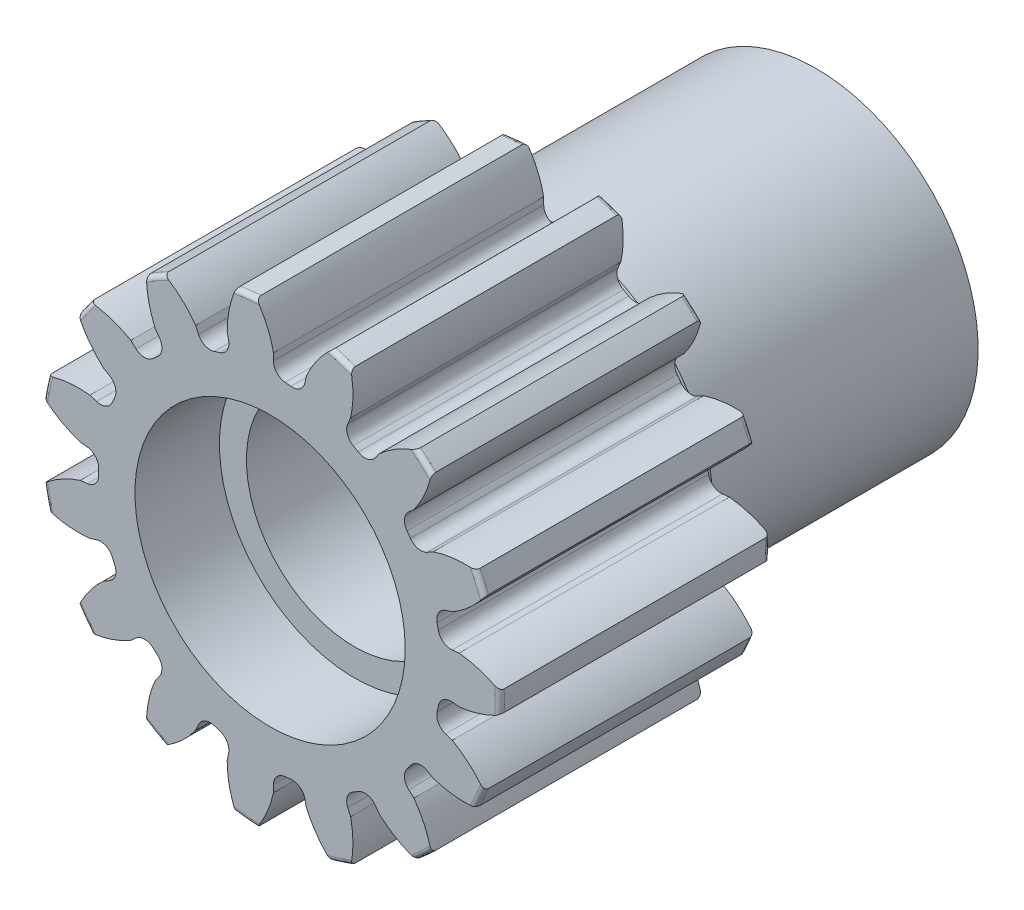
from build123d import *
from build123d.topology import SkipClean

# Parameters (mm, degrees)
SKETCH1_R                = 10.795
BOSS_EXTRUDE1_DEPTH      = 12.7
SKETCH2_W                = 11.176
SKETCH2_H                = 7.62
FILLET2_R                = 0.2159
CUT_EXTRUDE1_DEPTH       = 29.339503001
FILLET1_R                = 0.5984748
CIRPATTERN1_COUNT        = 15
FILLET1_OF_CIRPATTERN1_R = 0.5984748
SKETCH5_R                = 5.08
CUT_EXTRUDE2_DEPTH       = 29.332093844
SKETCH6_R                = 7.62
SKETCH6_R_2              = 5.08
BOSS_EXTRUDE2_DEPTH      = 1.778
SKETCH7_R                = 7.874
SKETCH7_R_2              = 7.62
BOSS_EXTRUDE3_DEPTH      = 0.254
SKETCH8_R                = 6.35
CUT_EXTRUDE3_DEPTH       = 3.96875
CUT_EXTRUDE4_START       = -3.96875
SKETCH9_R                = 6.35
CUT_EXTRUDE4_DEPTH       = 3.96875


with BuildPart() as part:
    # Sketch1 → Boss-Extrude1 (new body)
    with BuildSketch(Plane.XY):
        Circle(SKETCH1_R)
    extrude(amount=-BOSS_EXTRUDE1_DEPTH)

    # Sketch2 → Revolve1 (revolve)
    with BuildSketch(Plane(origin=(0, 0, 0), x_dir=(0, 0, -1), z_dir=(1, 0, 0))):
        with Locations((18.288, 3.81)):
            Rectangle(SKETCH2_W, SKETCH2_H)
    revolve(axis=Axis((0, 0, -12.7), (0, 0, -1)))

    # Fillet2
    fillet2_edges = [part.edges().sort_by_distance(p)[0] for p in [
        (-10.795, 0, -12.7),
        (-10.795, 0, 0),
    ]]
    fillet(fillet2_edges, radius=FILLET2_R)

    # Sketch4 → Cut-Extrude1 (cut, through all)
    with BuildSketch(Plane.XY):
        with BuildLine():
            Line((0.158117624, 8.949175479), (0.158117624, 8.054058063))
            ThreePointArc((0.158117624, 8.054058063), (0.842042496, 8.011480319), (1.51987433, 7.910931329))
            Line((1.51987433, 7.910931329), (1.705980134, 8.786488191))
            add(Edge.make_bspline(
                [(5.043237888, 11.616299545), (2.6061384, 10.812637333), (1.705980134, 8.786488191)],
                knots=[0, 0, 0, 1, 1, 1], degree=2))
            ThreePointArc((5.043237888, 11.616299545), (1.323734075, 12.594458766), (-2.517860482, 12.411004879))
            add(Edge.make_bspline(
                [(-2.517860482, 12.411004879), (-0.301108868, 11.118202053), (0.158117624, 8.949175479)],
                knots=[0, 0, 0, 1, 1, 1], degree=2))
        make_face()
    cut_extrude1 = extrude(amount=-CUT_EXTRUDE1_DEPTH, mode=Mode.SUBTRACT)

    # Fillet1
    fillet1_edges = [part.edges().sort_by_distance(p)[0] for p in [
        (1.51987433, 7.910931329, -6.35),
        (0.158117624, 8.054058063, -6.35),
    ]]
    fillet(fillet1_edges, radius=FILLET1_R)

    # CirPattern1: Cut-Extrude1 ×15 about axis
    cirpattern1_axis = Axis((0, 0, -12.7), (0, 0, 1))
    for i in range(1, CIRPATTERN1_COUNT):
        add(cut_extrude1.rotate(cirpattern1_axis, i * 360 / CIRPATTERN1_COUNT), mode=Mode.SUBTRACT)

    # Fillet1 of CirPattern1
    fillet1_of_cirpattern1_edges = [part.edges().sort_by_distance(p)[0] for p in [
        (-1.829191362, 7.845183964, -6.35),
        (-3.131432903, 7.422060391, -6.35),
        (-4.86197325, 6.422933021, -6.35),
        (-5.879530232, 5.50672105, -6.35),
        (-7.054075793, 3.890098607, -6.35),
        (-7.611003371, 2.639219612, -6.35),
        (-8.026464548, 0.684630804, -6.35),
        (-8.026464883, -0.684626873, -6.35),
        (-7.611004663, -2.639215884, -6.35),
        (-7.054077699, -3.890095152, -6.35),
        (-5.879532929, -5.50671817, -6.35),
        (-4.861976396, -6.422930639, -6.35),
        (-3.131436538, -7.422058857, -6.35),
        (-1.829195205, -7.845183068, -6.35),
        (0.15811368, -8.054058141, -6.35),
        (1.519870455, -7.910932073, -6.35),
        (3.420324605, -7.293437603, -6.35),
        (4.606136706, -6.608809055, -6.35),
        (6.091130334, -5.271715445, -6.35),
        (6.895960074, -4.163962911, -6.35),
        (7.708724292, -2.338465794, -6.35),
        (7.993409298, -0.999129752, -6.35),
        (7.993409788, 0.999125837, -6.35),
        (7.708725437, 2.338462019, -6.35),
        (6.895962114, 4.163959534, -6.35),
        (6.091132916, 5.271712461, -6.35),
        (4.606139942, 6.608806799, -6.35),
        (3.420328177, 7.293435928, -6.35),
    ]]
    fillet(fillet1_of_cirpattern1_edges, radius=FILLET1_OF_CIRPATTERN1_R)

    # Sketch5 → Cut-Extrude2 (cut, through all)
    with BuildSketch(Plane.XY):
        Circle(SKETCH5_R)
    extrude(amount=-CUT_EXTRUDE2_DEPTH, mode=Mode.SUBTRACT)

    # Sketch6 → Boss-Extrude2 (add)
    with SkipClean():  # the faces are left unmerged after this step: merging them gives an invalid solid
        with BuildSketch(Plane(origin=(0, 0, -23.876), x_dir=(-1, 0, 0), z_dir=(0, 0, -1))):
            Circle(SKETCH6_R)
            Circle(SKETCH6_R_2, mode=Mode.SUBTRACT)
        extrude(amount=BOSS_EXTRUDE2_DEPTH)

    # Sketch7 → Boss-Extrude3 (add)
    with SkipClean():  # the faces are left unmerged after this step: merging them gives an invalid solid
        with BuildSketch(Plane(origin=(0, 0, -12.7), x_dir=(-1, 0, 0), z_dir=(0, 0, -1))):
            Circle(SKETCH7_R)
            Circle(SKETCH7_R_2, mode=Mode.SUBTRACT)
        extrude(amount=BOSS_EXTRUDE3_DEPTH)

    # Sketch8 → Cut-Extrude3 (cut)
    with SkipClean():  # the faces are left unmerged after this step: merging them gives an invalid solid
        with BuildSketch(Plane.XY):
            Circle(SKETCH8_R)
        extrude(amount=-CUT_EXTRUDE3_DEPTH, mode=Mode.SUBTRACT)

    # Sketch9 → Cut-Extrude4 (cut)
    with BuildSketch(Plane(origin=(0, 0, -25.654), x_dir=(-1, 0, 0), z_dir=(0, 0, -1)).offset(CUT_EXTRUDE4_START)):
        Circle(SKETCH9_R)
    extrude(amount=CUT_EXTRUDE4_DEPTH, mode=Mode.SUBTRACT)


solid = part.part
